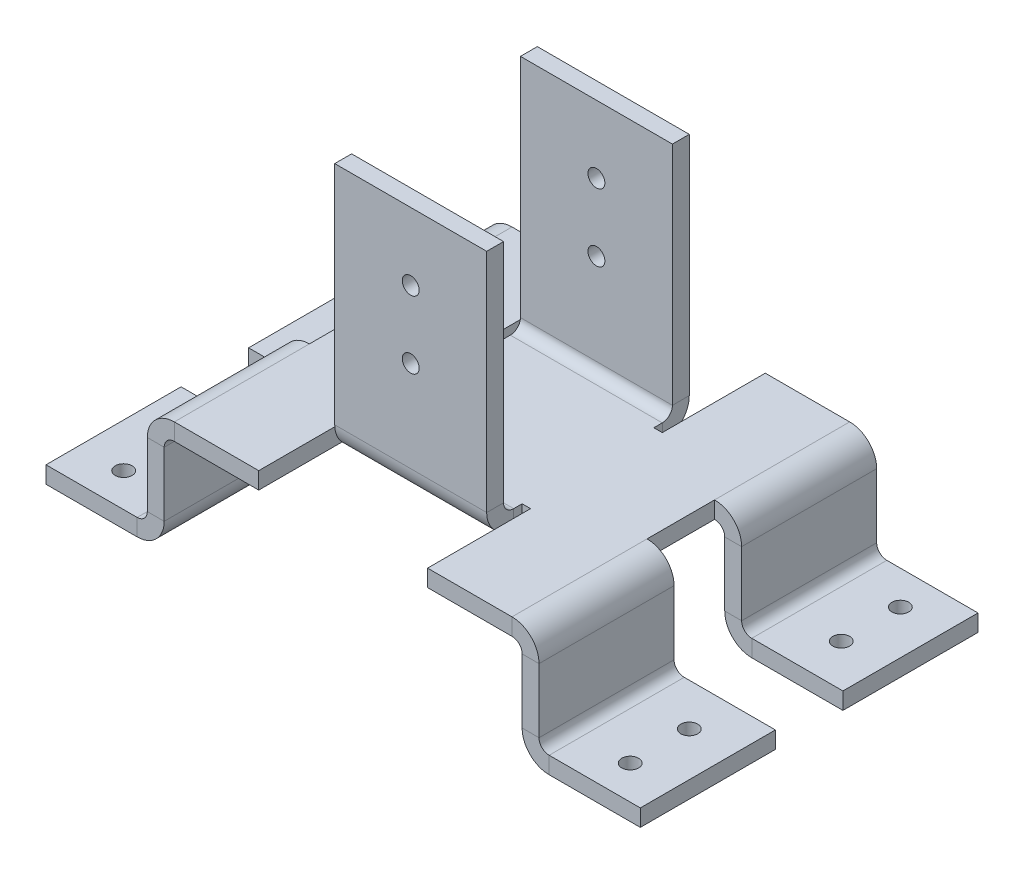
from build123d import *

# Parameters (mm, degrees)
SM_BASE_FLANGE_1_DEPTH            = 5
SM_EDGE_FLANGE_1_STRIP_W          = 26
SM_EDGE_FLANGE_1_STRIP_H          = 5
SM_EDGE_FLANGE_1_STRIP_CUT_DEPTH  = 45
SM_EDGE_FLANGE_1_RELIEF_W         = 28.5
SM_EDGE_FLANGE_1_RELIEF_H         = 2.5
SM_EDGE_FLANGE_1_RELIEF_CUT_DEPTH = 5
SM_EDGE_FLANGE_1_DEPTH            = 45
SM_EDGE_FLANGE_2_STRIP_W          = 26
SM_EDGE_FLANGE_2_STRIP_H          = 5
SM_EDGE_FLANGE_2_STRIP_CUT_DEPTH  = 45
SM_EDGE_FLANGE_2_RELIEF_W         = 28.5
SM_EDGE_FLANGE_2_RELIEF_H         = 2.5
SM_EDGE_FLANGE_2_RELIEF_CUT_DEPTH = 5
SM_EDGE_FLANGE_2_DEPTH            = 45
SM_EDGE_FLANGE_14_DEPTH           = 40
SM_EDGE_FLANGE_15_DEPTH           = 40
SM_EDGE_FLANGE_16_DEPTH           = 40
SM_EDGE_FLANGE_17_DEPTH           = 40
SM_EDGE_FLANGE_18_STRIP_W         = 26
SM_EDGE_FLANGE_18_STRIP_H         = 5
SM_EDGE_FLANGE_18_STRIP_CUT_DEPTH = 40
SM_EDGE_FLANGE_18_DEPTH           = 40
SM_EDGE_FLANGE_19_STRIP_W         = 26
SM_EDGE_FLANGE_19_STRIP_H         = 5
SM_EDGE_FLANGE_19_STRIP_CUT_DEPTH = 40
SM_EDGE_FLANGE_19_DEPTH           = 40
SM_EDGE_FLANGE_20_STRIP_W         = 26
SM_EDGE_FLANGE_20_STRIP_H         = 5
SM_EDGE_FLANGE_20_STRIP_CUT_DEPTH = 40
SM_EDGE_FLANGE_20_DEPTH           = 40
SM_EDGE_FLANGE_21_STRIP_W         = 26
SM_EDGE_FLANGE_21_STRIP_H         = 5
SM_EDGE_FLANGE_21_STRIP_CUT_DEPTH = 40
SM_EDGE_FLANGE_21_DEPTH           = 40
CUT_EXTRUDE_START                 = -35
SKETCH_80_R                       = 2.5
CUT_EXTRUDE_1_DEPTH               = 5
CUT_EXTRUDE_3_DEPTH               = 124.060960503
CUT_EXTRUDE_3_DEPTH_BACK          = 124.060960503
SKETCH_83_R                       = 2.5
CUT_EXTRUDE_START_2               = -30
SKETCH_84_R                       = 2.5
CUT_EXTRUDE_5_DEPTH               = 5


# Sheet-metal steps are written as plain solids
with BuildPart() as part:
    # Sketch 1 → 基体-法兰1 (new body)
    with BuildSketch(Plane(origin=(0, 0, 0), x_dir=(1, 0, 0), z_dir=(0, 1, 0))):
        Polygon((-25, -25), (-25, -50), (-50, -50), (-50, 50), (-25, 50), (-25, 25), (25, 25), (25, 50), (50, 50), (50, -50), (25, -50), (25, -25), align=None)
    extrude(amount=-SM_BASE_FLANGE_1_DEPTH)

    # 边线-法兰1 strip (across the edge) → 边线-法兰1 strip cut (cut)
    with BuildSketch(Plane(origin=(22.5, 0, -25), x_dir=(0, 0, 1), z_dir=(-1, 0, 0))):
        with Locations((-10, -2.5)):
            Rectangle(SM_EDGE_FLANGE_1_STRIP_W, SM_EDGE_FLANGE_1_STRIP_H)
    extrude(amount=SM_EDGE_FLANGE_1_STRIP_CUT_DEPTH, mode=Mode.SUBTRACT)

    # 边线-法兰1 relief (on the sheet) → 边线-法兰1 relief cut (cut)
    with BuildSketch(Plane(origin=(22.5, 0, -22), x_dir=(0, 0, 1), z_dir=(0, 1, 0))):
        with Locations((-11.75, 1.25)):
            Rectangle(SM_EDGE_FLANGE_1_RELIEF_W, SM_EDGE_FLANGE_1_RELIEF_H)
        with Locations((-11.75, -46.25)):
            Rectangle(SM_EDGE_FLANGE_1_RELIEF_W, SM_EDGE_FLANGE_1_RELIEF_H)
    extrude(amount=-SM_EDGE_FLANGE_1_RELIEF_CUT_DEPTH, mode=Mode.SUBTRACT)

    # 边线-法兰1 section (across the edge) → 边线-法兰1 (add)
    with BuildSketch(Plane(origin=(22.5, 0, -25), x_dir=(0, 0, 1), z_dir=(-1, 0, 0))):
        with BuildLine():
            Line((-5, 3), (-5, 70))
            Line((-5, 70), (0, 70))
            Line((0, 70), (0, 3))
            ThreePointArc((0, 3), (0.878679656, 0.878679656), (3, 0))
            Line((3, 0), (3, -5))
            ThreePointArc((3, -5), (-2.656854249, -2.656854249), (-5, 3))
        make_face()
    extrude(amount=SM_EDGE_FLANGE_1_DEPTH)

    # 边线-法兰2 strip (across the edge) → 边线-法兰2 strip cut (cut)
    with BuildSketch(Plane(origin=(-22.5, 0, 25), x_dir=(0, 0, -1), z_dir=(1, 0, 0))):
        with Locations((-10, -2.5)):
            Rectangle(SM_EDGE_FLANGE_2_STRIP_W, SM_EDGE_FLANGE_2_STRIP_H)
    extrude(amount=SM_EDGE_FLANGE_2_STRIP_CUT_DEPTH, mode=Mode.SUBTRACT)

    # 边线-法兰2 relief (on the sheet) → 边线-法兰2 relief cut (cut)
    with BuildSketch(Plane(origin=(-22.5, 0, 22), x_dir=(0, 0, -1), z_dir=(0, 1, 0))):
        with Locations((-11.75, 1.25)):
            Rectangle(SM_EDGE_FLANGE_2_RELIEF_W, SM_EDGE_FLANGE_2_RELIEF_H)
        with Locations((-11.75, -46.25)):
            Rectangle(SM_EDGE_FLANGE_2_RELIEF_W, SM_EDGE_FLANGE_2_RELIEF_H)
    extrude(amount=-SM_EDGE_FLANGE_2_RELIEF_CUT_DEPTH, mode=Mode.SUBTRACT)

    # 边线-法兰2 section (across the edge) → 边线-法兰2 (add)
    with BuildSketch(Plane(origin=(-22.5, 0, 25), x_dir=(0, 0, -1), z_dir=(1, 0, 0))):
        with BuildLine():
            Line((-5, 3), (-5, 70))
            Line((-5, 70), (0, 70))
            Line((0, 70), (0, 3))
            ThreePointArc((0, 3), (0.878679656, 0.878679656), (3, 0))
            Line((3, 0), (3, -5))
            ThreePointArc((3, -5), (-2.656854249, -2.656854249), (-5, 3))
        make_face()
    extrude(amount=SM_EDGE_FLANGE_2_DEPTH)

    # 边线-法兰14 section (across the edge) → 边线-法兰14 (add)
    with BuildSketch(Plane(origin=(53, -5, 10), x_dir=(-1, 0, 0), z_dir=(0, 0, 1))):
        with BuildLine():
            Line((-5, 3), (-5, 30))
            Line((-5, 30), (0, 30))
            Line((0, 30), (0, 3))
            ThreePointArc((0, 3), (0.878679656, 0.878679656), (3, 0))
            Line((3, 0), (3, -5))
            ThreePointArc((3, -5), (-2.656854249, -2.656854249), (-5, 3))
        make_face()
    extrude(amount=SM_EDGE_FLANGE_14_DEPTH)

    # 边线-法兰15 section (across the edge) → 边线-法兰15 (add)
    with BuildSketch(Plane(origin=(53, -5, -50), x_dir=(-1, 0, 0), z_dir=(0, 0, 1))):
        with BuildLine():
            Line((-5, 3), (-5, 30))
            Line((-5, 30), (0, 30))
            Line((0, 30), (0, 3))
            ThreePointArc((0, 3), (0.878679656, 0.878679656), (3, 0))
            Line((3, 0), (3, -5))
            ThreePointArc((3, -5), (-2.656854249, -2.656854249), (-5, 3))
        make_face()
    extrude(amount=SM_EDGE_FLANGE_15_DEPTH)

    # 边线-法兰16 section (across the edge) → 边线-法兰16 (add)
    with BuildSketch(Plane(origin=(-53, -5, -10), x_dir=(1, 0, 0), z_dir=(0, 0, -1))):
        with BuildLine():
            Line((-5, 3), (-5, 30))
            Line((-5, 30), (0, 30))
            Line((0, 30), (0, 3))
            ThreePointArc((0, 3), (0.878679656, 0.878679656), (3, 0))
            Line((3, 0), (3, -5))
            ThreePointArc((3, -5), (-2.656854249, -2.656854249), (-5, 3))
        make_face()
    extrude(amount=SM_EDGE_FLANGE_16_DEPTH)

    # 边线-法兰17 section (across the edge) → 边线-法兰17 (add)
    with BuildSketch(Plane(origin=(-53, -5, 50), x_dir=(1, 0, 0), z_dir=(0, 0, -1))):
        with BuildLine():
            Line((-5, 3), (-5, 30))
            Line((-5, 30), (0, 30))
            Line((0, 30), (0, 3))
            ThreePointArc((0, 3), (0.878679656, 0.878679656), (3, 0))
            Line((3, 0), (3, -5))
            ThreePointArc((3, -5), (-2.656854249, -2.656854249), (-5, 3))
        make_face()
    extrude(amount=SM_EDGE_FLANGE_17_DEPTH)

    # 边线-法兰18 strip (across the edge) → 边线-法兰18 strip cut (cut)
    with BuildSketch(Plane(origin=(-58, -35, -50), x_dir=(0, 1, 0), z_dir=(0, 0, 1))):
        with Locations((-5, -2.5)):
            Rectangle(SM_EDGE_FLANGE_18_STRIP_W, SM_EDGE_FLANGE_18_STRIP_H)
    extrude(amount=SM_EDGE_FLANGE_18_STRIP_CUT_DEPTH, mode=Mode.SUBTRACT)

    # 边线-法兰18 section (across the edge) → 边线-法兰18 (add)
    with BuildSketch(Plane(origin=(-58, -35, -50), x_dir=(0, 1, 0), z_dir=(0, 0, 1))):
        with BuildLine():
            Line((0, 3), (0, 30))
            Line((0, 30), (5, 30))
            Line((5, 30), (5, 3))
            ThreePointArc((5, 3), (5.878679656, 0.878679656), (8, 0))
            Line((8, 0), (8, -5))
            ThreePointArc((8, -5), (2.343145751, -2.656854249), (0, 3))
        make_face()
    extrude(amount=SM_EDGE_FLANGE_18_DEPTH)

    # 边线-法兰19 strip (across the edge) → 边线-法兰19 strip cut (cut)
    with BuildSketch(Plane(origin=(-58, -35, 10), x_dir=(0, 1, 0), z_dir=(0, 0, 1))):
        with Locations((-5, -2.5)):
            Rectangle(SM_EDGE_FLANGE_19_STRIP_W, SM_EDGE_FLANGE_19_STRIP_H)
    extrude(amount=SM_EDGE_FLANGE_19_STRIP_CUT_DEPTH, mode=Mode.SUBTRACT)

    # 边线-法兰19 section (across the edge) → 边线-法兰19 (add)
    with BuildSketch(Plane(origin=(-58, -35, 10), x_dir=(0, 1, 0), z_dir=(0, 0, 1))):
        with BuildLine():
            Line((0, 3), (0, 30))
            Line((0, 30), (5, 30))
            Line((5, 30), (5, 3))
            ThreePointArc((5, 3), (5.878679656, 0.878679656), (8, 0))
            Line((8, 0), (8, -5))
            ThreePointArc((8, -5), (2.343145751, -2.656854249), (0, 3))
        make_face()
    extrude(amount=SM_EDGE_FLANGE_19_DEPTH)

    # 边线-法兰20 strip (across the edge) → 边线-法兰20 strip cut (cut)
    with BuildSketch(Plane(origin=(58, -35, 50), x_dir=(0, 1, 0), z_dir=(0, 0, -1))):
        with Locations((-5, -2.5)):
            Rectangle(SM_EDGE_FLANGE_20_STRIP_W, SM_EDGE_FLANGE_20_STRIP_H)
    extrude(amount=SM_EDGE_FLANGE_20_STRIP_CUT_DEPTH, mode=Mode.SUBTRACT)

    # 边线-法兰20 section (across the edge) → 边线-法兰20 (add)
    with BuildSketch(Plane(origin=(58, -35, 50), x_dir=(0, 1, 0), z_dir=(0, 0, -1))):
        with BuildLine():
            Line((0, 3), (0, 30))
            Line((0, 30), (5, 30))
            Line((5, 30), (5, 3))
            ThreePointArc((5, 3), (5.878679656, 0.878679656), (8, 0))
            Line((8, 0), (8, -5))
            ThreePointArc((8, -5), (2.343145751, -2.656854249), (0, 3))
        make_face()
    extrude(amount=SM_EDGE_FLANGE_20_DEPTH)

    # 边线-法兰21 strip (across the edge) → 边线-法兰21 strip cut (cut)
    with BuildSketch(Plane(origin=(58, -35, -10), x_dir=(0, 1, 0), z_dir=(0, 0, -1))):
        with Locations((-5, -2.5)):
            Rectangle(SM_EDGE_FLANGE_21_STRIP_W, SM_EDGE_FLANGE_21_STRIP_H)
    extrude(amount=SM_EDGE_FLANGE_21_STRIP_CUT_DEPTH, mode=Mode.SUBTRACT)

    # 边线-法兰21 section (across the edge) → 边线-法兰21 (add)
    with BuildSketch(Plane(origin=(58, -35, -10), x_dir=(0, 1, 0), z_dir=(0, 0, -1))):
        with BuildLine():
            Line((0, 3), (0, 30))
            Line((0, 30), (5, 30))
            Line((5, 30), (5, 3))
            ThreePointArc((5, 3), (5.878679656, 0.878679656), (8, 0))
            Line((8, 0), (8, -5))
            ThreePointArc((8, -5), (2.343145751, -2.656854249), (0, 3))
        make_face()
    extrude(amount=SM_EDGE_FLANGE_21_DEPTH)

    # 草图80 → 切除-拉伸1 (cut)
    with BuildSketch(Plane(origin=(0, 0, 0), x_dir=(1, 0, 0), z_dir=(0, 1, 0)).offset(CUT_EXTRUDE_START)):
        with Locations(Location((-75, 40, 0), (0, 0, 270))):
            Circle(SKETCH_80_R)
        with Locations(Location((75, 40, 0), (0, 0, 270))):
            Circle(SKETCH_80_R)
        with Locations(Location((-75, -40, 0), (0, 0, 270))):
            Circle(SKETCH_80_R)
        with Locations(Location((75, -40, 0), (0, 0, 270))):
            Circle(SKETCH_80_R)
    extrude(amount=CUT_EXTRUDE_1_DEPTH, mode=Mode.SUBTRACT)

    # 草图83 → 切除-拉伸3 (cut, two sides: drawn at the far end of the back side and taken through both)
    with BuildSketch(Plane.XY.offset(-CUT_EXTRUDE_3_DEPTH_BACK)):
        with Locations((0, 50)):
            Circle(SKETCH_83_R)
        with Locations((0, 30)):
            Circle(SKETCH_83_R)
    extrude(amount=CUT_EXTRUDE_3_DEPTH + CUT_EXTRUDE_3_DEPTH_BACK, mode=Mode.SUBTRACT)

    # 草图84 → 切除-拉伸5 (cut)
    with BuildSketch(Plane(origin=(0, 0, 0), x_dir=(1, 0, 0), z_dir=(0, 1, 0)).offset(CUT_EXTRUDE_START_2)):
        with Locations(Location((75, 22.5, 0), (0, 0, 270))):
            Circle(SKETCH_84_R)
        with Locations(Location((75, -22.5, 0), (0, 0, 270))):
            Circle(SKETCH_84_R)
        with Locations(Location((-75, -22.5, 0), (0, 0, 270))):
            Circle(SKETCH_84_R)
        with Locations(Location((-75, 22.5, 0), (0, 0, 270))):
            Circle(SKETCH_84_R)
    extrude(amount=-CUT_EXTRUDE_5_DEPTH, mode=Mode.SUBTRACT)


solid = part.part
